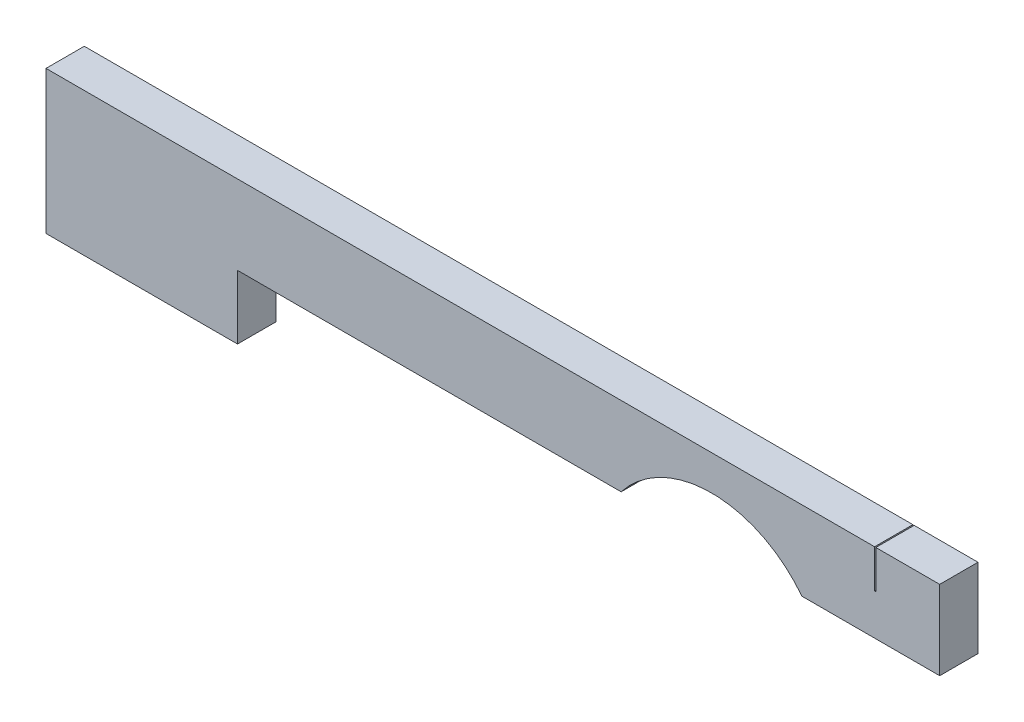
from build123d import *

# Parameters (mm, degrees)
BOSS_EXTRUDE1_DEPTH = 3
SKETCH3_W           = 0.1
SKETCH3_H           = 3
CUT_EXTRUDE1_DEPTH  = 3
SKETCH4_R           = 8.961334226
CUT_EXTRUDE2_DEPTH  = 10


with BuildPart() as part:
    # Sketch1 → Boss-Extrude1 (new body)
    with BuildSketch(Plane.XY):
        Polygon((0, 0), (0, 11.2), (70, 11.2), (70, 5), (15, 5), (15, 0), align=None)
    extrude(amount=BOSS_EXTRUDE1_DEPTH)

    # Sketch3 → Cut-Extrude1 (cut)
    with BuildSketch(Plane(origin=(0, 11.2, 0), x_dir=(1, 0, 0), z_dir=(0, 1, 0))):
        with Locations((64.95, -1.5)):
            Rectangle(SKETCH3_W, SKETCH3_H)
    extrude(amount=-CUT_EXTRUDE1_DEPTH, mode=Mode.SUBTRACT)

    # Sketch4 → Cut-Extrude2 (cut)
    with BuildSketch(Plane.XY.offset(3)):
        with Locations((52.128815452, -0.494128896)):
            Circle(SKETCH4_R)
    extrude(amount=-CUT_EXTRUDE2_DEPTH, mode=Mode.SUBTRACT)


solid = part.part
